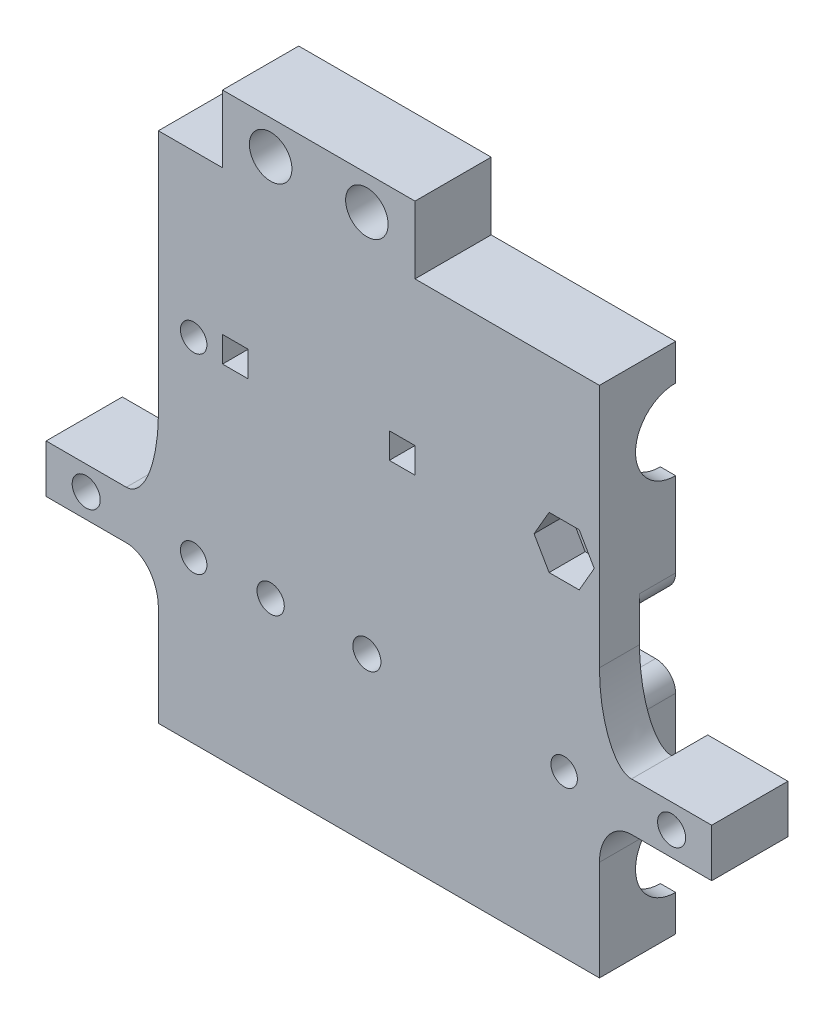
from build123d import *

# Parameters (mm, degrees)
SZKIC8_W                        = 55
SZKIC8_H                        = 64
DODANIE_WYCI_GNI_CIE3_DEPTH     = 9.5
WYTNIJ_WYCI_GNI_CIE2_START      = -1.9
SZKIC9_R                        = 7.6
WYTNIJ_WYCI_GNI_CIE2_DEPTH      = 24.2
WYTNIJ_WYCI_GNI_CIE3_START      = -1.9
SZKIC10_R                       = 7.65
WYTNIJ_WYCI_GNI_CIE3_DEPTH      = 24.2
WYTNIJ_WYCI_GNI_CIE4_DEPTH      = 71.763691255
WYTNIJ_WYCI_GNI_CIE4_DEPTH_BACK = 71.763691255
SZKIC11_R                       = 5
WYTNIJ_WYCI_GNI_CIE25_REACH     = 54.333
SZKIC42_R                       = 1.65
SZKIC43_W                       = 24
SZKIC43_H                       = 8.4
DODANIE_WYCI_GNI_CIE4_DEPTH     = 9.5
WYTNIJ_WYCI_GNI_CIE26_REACH     = 61.499
SZKIC44_R                       = 2.65
SZKIC45_W                       = 3.2
SZKIC45_H                       = 3.2
WYTNIJ_WYCI_GNI_CIE27_DEPTH     = 3.4
SZKIC46_R                       = 1.7
SZKIC46_R_2                     = 1.75
WYTNIJ_WYCI_GNI_CIE28_DEPTH     = 60.498823518
WYTNIJ_WYCI_GNI_CIE29_DEPTH     = 4.5
SZKIC49_W                       = 10
SZKIC49_H                       = 6
DODANIE_WYCI_GNI_CIE5_DEPTH     = 4.5
DODANIE_WYCI_GNI_CIE5_2_DEPTH   = 4.5
SZKIC50_W                       = 14
SZKIC50_H                       = 6
DODANIE_WYCI_GNI_CIE6_DEPTH     = 5
WYTNIJ_WYCI_GNI_CIE31_REACH     = 69.128
SZKIC51_R                       = 1.75
ZAOKR_GLENIE2_SIZE              = 10
ZAOKR_GLENIE2_SIZE_2            = 4
ZAOKR_GLENIE3_SIZE              = 4
ZAOKR_GLENIE3_SIZE_2            = 5
SZKIC52_W                       = 55
SZKIC52_H                       = 8
WYTNIJ_WYCI_GNI_CIE32_DEPTH     = 4.5
ZAOKR_GLENIE4_R                 = 2.5


with BuildPart() as part:
    # Szkic8 → Dodanie-wyciągnięcie3 (new body)
    with BuildSketch(Plane.XY):
        with Locations((0, 11.5)):
            Rectangle(SZKIC8_W, SZKIC8_H)
    extrude(amount=DODANIE_WYCI_GNI_CIE3_DEPTH)

    # Szkic9 → Wytnij-wyciągnięcie2 (cut)
    with BuildSketch(Plane(origin=(27.5, 0, 0), x_dir=(0, 0, -1), z_dir=(1, 0, 0)).offset(WYTNIJ_WYCI_GNI_CIE2_START)):
        with Locations((0, 34)):
            Circle(SZKIC9_R)
    wytnij_wyci_gni_cie2 = extrude(amount=-WYTNIJ_WYCI_GNI_CIE2_DEPTH, mode=Mode.SUBTRACT)

    # Szkic10 → Wytnij-wyciągnięcie3 (cut)
    with BuildSketch(Plane(origin=(27.5, 0, 0), x_dir=(0, 0, -1), z_dir=(1, 0, 0)).offset(WYTNIJ_WYCI_GNI_CIE3_START)):
        with Locations((0, -11)):
            Circle(SZKIC10_R)
    wytnij_wyci_gni_cie3 = extrude(amount=-WYTNIJ_WYCI_GNI_CIE3_DEPTH, mode=Mode.SUBTRACT)

    # Lustro4: Wytnij-wyciągnięcie2, Wytnij-wyciągnięcie3 across plane
    add(wytnij_wyci_gni_cie2.mirror(Plane(origin=(0, 0, 0), x_dir=(0, 0, 1), z_dir=(1, 0, 0))), mode=Mode.SUBTRACT)
    add(wytnij_wyci_gni_cie3.mirror(Plane(origin=(0, 0, 0), x_dir=(0, 0, 1), z_dir=(1, 0, 0))), mode=Mode.SUBTRACT)

    # Szkic11 → Wytnij-wyciągnięcie4 (cut, two sides: drawn at the far end of the back side and taken through both)
    with BuildSketch(Plane(origin=(27.5, 0, 0), x_dir=(0, 0, -1), z_dir=(1, 0, 0)).offset(-WYTNIJ_WYCI_GNI_CIE4_DEPTH_BACK)):
        with Locations((0, 34)):
            Circle(SZKIC11_R)
        with Locations((0, -11)):
            Circle(SZKIC11_R)
    extrude(amount=WYTNIJ_WYCI_GNI_CIE4_DEPTH + WYTNIJ_WYCI_GNI_CIE4_DEPTH_BACK, mode=Mode.SUBTRACT)

    # Szkic42 → Wytnij-wyciągnięcie25 (cut, up to next)
    with BuildSketch(Plane(origin=(0, 0, 0), x_dir=(-1, 0, 0), z_dir=(0, 0, -1)), mode=Mode.PRIVATE) as wytnij_wyci_gni_cie25_sk1:
        with Locations((23.1, 23.4)):
            Circle(SZKIC42_R)
    wytnij_wyci_gni_cie25_tool1 = extrude(wytnij_wyci_gni_cie25_sk1.sketch, amount=-WYTNIJ_WYCI_GNI_CIE25_REACH, mode=Mode.PRIVATE) & part.part
    # Szkic42 → Wytnij-wyciągnięcie25 (cut, up to next)
    with BuildSketch(Plane(origin=(0, 0, 0), x_dir=(-1, 0, 0), z_dir=(0, 0, -1)), mode=Mode.PRIVATE) as wytnij_wyci_gni_cie25_sk2:
        with Locations((23.1, -0.4)):
            Circle(SZKIC42_R)
    wytnij_wyci_gni_cie25_tool2 = extrude(wytnij_wyci_gni_cie25_sk2.sketch, amount=-WYTNIJ_WYCI_GNI_CIE25_REACH, mode=Mode.PRIVATE) & part.part
    # Szkic42 → Wytnij-wyciągnięcie25 (cut, up to next)
    with BuildSketch(Plane(origin=(0, 0, 0), x_dir=(-1, 0, 0), z_dir=(0, 0, -1)), mode=Mode.PRIVATE) as wytnij_wyci_gni_cie25_sk3:
        with Locations((-23.1, -0.4)):
            Circle(SZKIC42_R)
    wytnij_wyci_gni_cie25_tool3 = extrude(wytnij_wyci_gni_cie25_sk3.sketch, amount=-WYTNIJ_WYCI_GNI_CIE25_REACH, mode=Mode.PRIVATE) & part.part
    # Szkic42 → Wytnij-wyciągnięcie25 (cut, up to next)
    with BuildSketch(Plane(origin=(0, 0, 0), x_dir=(-1, 0, 0), z_dir=(0, 0, -1)), mode=Mode.PRIVATE) as wytnij_wyci_gni_cie25_sk4:
        with Locations((-23.1, 23.4)):
            Circle(SZKIC42_R)
    wytnij_wyci_gni_cie25_tool4 = extrude(wytnij_wyci_gni_cie25_sk4.sketch, amount=-WYTNIJ_WYCI_GNI_CIE25_REACH, mode=Mode.PRIVATE) & part.part
    add(wytnij_wyci_gni_cie25_tool1.solids().sort_by_distance((-23.1, 23.4, 0))[0], mode=Mode.SUBTRACT)
    add(wytnij_wyci_gni_cie25_tool2.solids().sort_by_distance((-23.1, -0.4, 0))[0], mode=Mode.SUBTRACT)
    add(wytnij_wyci_gni_cie25_tool3.solids().sort_by_distance((23.1, -0.4, 0))[0], mode=Mode.SUBTRACT)
    add(wytnij_wyci_gni_cie25_tool4.solids().sort_by_distance((23.1, 23.4, 0))[0], mode=Mode.SUBTRACT)

    # Szkic43 → Dodanie-wyciągnięcie4 (add)
    with BuildSketch(Plane.XY.offset(9.5)):
        with Locations((-7.5, 47.7)):
            Rectangle(SZKIC43_W, SZKIC43_H)
    extrude(amount=-DODANIE_WYCI_GNI_CIE4_DEPTH)

    # Szkic44 → Wytnij-wyciągnięcie26 (cut, up to next)
    with BuildSketch(Plane.XY.offset(9.5), mode=Mode.PRIVATE) as wytnij_wyci_gni_cie26_sk1:
        with Locations((-13.5, 47.7)):
            Circle(SZKIC44_R)
    wytnij_wyci_gni_cie26_tool1 = extrude(wytnij_wyci_gni_cie26_sk1.sketch, amount=-WYTNIJ_WYCI_GNI_CIE26_REACH, mode=Mode.PRIVATE) & part.part
    # Szkic44 → Wytnij-wyciągnięcie26 (cut, up to next)
    with BuildSketch(Plane.XY.offset(9.5), mode=Mode.PRIVATE) as wytnij_wyci_gni_cie26_sk2:
        with Locations((-1.5, 47.7)):
            Circle(SZKIC44_R)
    wytnij_wyci_gni_cie26_tool2 = extrude(wytnij_wyci_gni_cie26_sk2.sketch, amount=-WYTNIJ_WYCI_GNI_CIE26_REACH, mode=Mode.PRIVATE) & part.part
    add(wytnij_wyci_gni_cie26_tool1.solids().sort_by_distance((-13.5, 47.7, 9.5))[0], mode=Mode.SUBTRACT)
    add(wytnij_wyci_gni_cie26_tool2.solids().sort_by_distance((-1.5, 47.7, 9.5))[0], mode=Mode.SUBTRACT)

    # Szkic45 → Wytnij-wyciągnięcie27 (cut)
    with BuildSketch(Plane.XY.offset(9.5)):
        with Locations((-17.9, 23.9)):
            Rectangle(SZKIC45_W, SZKIC45_H)
        with Locations((2.9, 23.9)):
            Rectangle(SZKIC45_W, SZKIC45_H)
    extrude(amount=-WYTNIJ_WYCI_GNI_CIE27_DEPTH, mode=Mode.SUBTRACT)

    # Szkic46 → Wytnij-wyciągnięcie28 (cut, through all)
    with BuildSketch(Plane.XY.offset(9.5)):
        with Locations((-13.5, 0)):
            Circle(SZKIC46_R)
        with Locations((-1.5, 0)):
            Circle(SZKIC46_R_2)
    extrude(amount=-WYTNIJ_WYCI_GNI_CIE28_DEPTH, mode=Mode.SUBTRACT)

    # Szkic47 → Wytnij-wyciągnięcie29 (cut)
    with BuildSketch(Plane.XY.offset(9.5)):
        Polygon((21.223611625, 20.15), (24.976388375, 20.15), (26.85277675, 23.4), (24.976388375, 26.65), (21.223611625, 26.65), (19.34722325, 23.4), align=None)
    extrude(amount=-WYTNIJ_WYCI_GNI_CIE29_DEPTH, mode=Mode.SUBTRACT)



with BuildPart() as body_2:
    # Szkic49 → Dodanie-wyciągnięcie5 (new body)
    with BuildSketch(Plane(origin=(0, 0, 0), x_dir=(-1, 0, 0), z_dir=(0, 0, -1))):
        with Locations((36.5, 0)):
            Rectangle(SZKIC49_W, SZKIC49_H)
    extrude(amount=-DODANIE_WYCI_GNI_CIE5_DEPTH)


with BuildPart() as body_3:
    # Szkic49 → Dodanie-wyci_gni_cie5 2 (new body)
    with BuildSketch(Plane(origin=(0, 0, 0), x_dir=(-1, 0, 0), z_dir=(0, 0, -1))):
        with Locations((-36.5, 0)):
            Rectangle(SZKIC49_W, SZKIC49_H)
    extrude(amount=-DODANIE_WYCI_GNI_CIE5_2_DEPTH)


with BuildPart() as part_1:
    add(part.part)

    add(body_2.part)  # Dodanie-wyciągnięcie6 merges body 2

    add(body_3.part)  # Dodanie-wyciągnięcie6 merges body 3
    # Szkic50 → Dodanie-wyciągnięcie6 (add)
    with BuildSketch(Plane.XY.offset(4.5)):
        with Locations((-34.5, 0)):
            Rectangle(SZKIC50_W, SZKIC50_H)
        with Locations((34.5, 0)):
            Rectangle(SZKIC50_W, SZKIC50_H)
    extrude(amount=DODANIE_WYCI_GNI_CIE6_DEPTH)

    # Szkic51 → Wytnij-wyciągnięcie31 (cut, up to next)
    with BuildSketch(Plane(origin=(0, 0, 0), x_dir=(-1, 0, 0), z_dir=(0, 0, -1)), mode=Mode.PRIVATE) as wytnij_wyci_gni_cie31_sk1:
        with Locations((36.5, 0)):
            Circle(SZKIC51_R)
    wytnij_wyci_gni_cie31_tool1 = extrude(wytnij_wyci_gni_cie31_sk1.sketch, amount=-WYTNIJ_WYCI_GNI_CIE31_REACH, mode=Mode.PRIVATE) & part_1.part
    # Szkic51 → Wytnij-wyciągnięcie31 (cut, up to next)
    with BuildSketch(Plane(origin=(0, 0, 0), x_dir=(-1, 0, 0), z_dir=(0, 0, -1)), mode=Mode.PRIVATE) as wytnij_wyci_gni_cie31_sk2:
        with Locations(Location((-36.5, 0, 0), (0, 0, 180))):
            Circle(SZKIC51_R)
    wytnij_wyci_gni_cie31_tool2 = extrude(wytnij_wyci_gni_cie31_sk2.sketch, amount=-WYTNIJ_WYCI_GNI_CIE31_REACH, mode=Mode.PRIVATE) & part_1.part
    add(wytnij_wyci_gni_cie31_tool1.solids().sort_by_distance((-36.5, 0, 0))[0], mode=Mode.SUBTRACT)
    add(wytnij_wyci_gni_cie31_tool2.solids().sort_by_distance((36.5, 0, 0))[0], mode=Mode.SUBTRACT)

    # Zaokrąglenie2
    # an asymmetric fillet: 10, 4 mm, written as the material it adds along each edge
    with BuildSketch(Plane(origin=(-27.5, 3, 4.5), x_dir=(0, 1, 0), z_dir=(0, 0, 1))) as zaokr_glenie2_piece_1:
        with BuildLine():
            Bezier((ZAOKR_GLENIE2_SIZE, 0), (0, 0), (0, ZAOKR_GLENIE2_SIZE_2), weights=[1, 0.707106781, 1])
            Line((0, ZAOKR_GLENIE2_SIZE_2), (0, 0))
            Line((0, 0), (ZAOKR_GLENIE2_SIZE, 0))
        make_face()
    extrude(amount=5)
    with BuildSketch(Plane(origin=(27.5, 3, 4.5), x_dir=(0, 1, 0), z_dir=(0, 0, 1))) as zaokr_glenie2_piece_2:
        with BuildLine():
            Bezier((ZAOKR_GLENIE2_SIZE, 0), (0, 0), (0, -ZAOKR_GLENIE2_SIZE_2), weights=[1, 0.707106781, 1])
            Line((0, -ZAOKR_GLENIE2_SIZE_2), (0, 0))
            Line((0, 0), (ZAOKR_GLENIE2_SIZE, 0))
        make_face()
    extrude(amount=5)

    # Zaokrąglenie3
    # an asymmetric fillet: 5, 4 mm, written as the material it adds along each edge
    with BuildSketch(Plane(origin=(-27.5, -3, 4.5), x_dir=(-1, 0, 0), z_dir=(0, 0, 1))) as zaokr_glenie3_piece_1:
        with BuildLine():
            Bezier((ZAOKR_GLENIE3_SIZE, 0), (0, 0), (0, ZAOKR_GLENIE3_SIZE_2), weights=[1, 0.707106781, 1])
            Line((0, ZAOKR_GLENIE3_SIZE_2), (0, 0))
            Line((0, 0), (ZAOKR_GLENIE3_SIZE, 0))
        make_face()
    extrude(amount=5)
    with BuildSketch(Plane(origin=(27.5, -3, 4.5), x_dir=(1, 0, 0), z_dir=(0, 0, 1))) as zaokr_glenie3_piece_2:
        with BuildLine():
            Bezier((ZAOKR_GLENIE3_SIZE, 0), (0, 0), (0, -ZAOKR_GLENIE3_SIZE_2), weights=[1, 0.707106781, 1])
            Line((0, -ZAOKR_GLENIE3_SIZE_2), (0, 0))
            Line((0, 0), (ZAOKR_GLENIE3_SIZE, 0))
        make_face()
    extrude(amount=5)

    # Szkic52 → Wytnij-wyciągnięcie32 (cut)
    with BuildSketch(Plane(origin=(0, 0, 0), x_dir=(-1, 0, 0), z_dir=(0, 0, -1))):
        with Locations((0, 12)):
            Rectangle(SZKIC52_W, SZKIC52_H)
    extrude(amount=-WYTNIJ_WYCI_GNI_CIE32_DEPTH, mode=Mode.SUBTRACT)

    # Zaokrąglenie4
    zaokr_glenie4_edges = [part_1.edges().sort_by_distance(p)[0] for p in [
        (27.5, 8, 2.25),
        (27.5, 16, 2.25),
        (-27.5, 8, 2.25),
        (-27.5, 16, 2.25),
    ]]
    fillet(zaokr_glenie4_edges, radius=ZAOKR_GLENIE4_R)


solid = part_1.part
